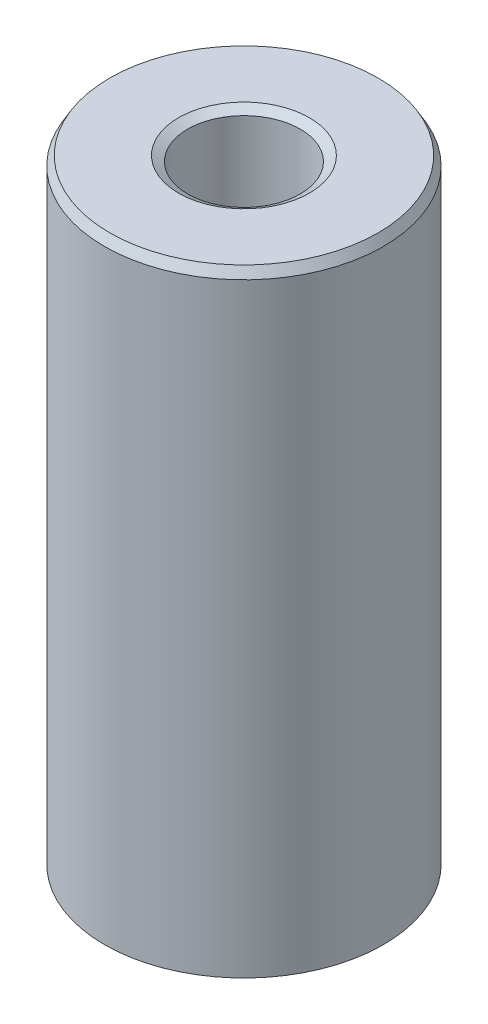
from build123d import *
from OCP.BRepFilletAPI import BRepFilletAPI_MakeChamfer

# Parameters (mm, degrees)
SKETCH1_R           = 12.5
BOSS_EXTRUDE1_DEPTH = 55.499589055
SKETCH2_R           = 5.042797886
CUT_EXTRUDE1_DEPTH  = 59.246925973
CHAMFER1_SIZE       = 0.820099803
CHAMFER1_SIZE2      = 0.473484842


with BuildPart() as part:
    # Sketch1 → Boss-Extrude1 (new body)
    with BuildSketch(Plane(origin=(0, 0, 0), x_dir=(1, 0, 0), z_dir=(0, 1, 0))):
        Circle(SKETCH1_R)
    extrude(amount=BOSS_EXTRUDE1_DEPTH)

    # Sketch2 → Cut-Extrude1 (cut, through all)
    with BuildSketch(Plane(origin=(0, 0, 0), x_dir=(1, 0, 0), z_dir=(0, 1, 0))):
        Circle(SKETCH2_R)
    extrude(amount=CUT_EXTRUDE1_DEPTH, mode=Mode.SUBTRACT)

    # Chamfer1: one chamfer whose edges measure the first distance from different faces: ONE call of the kernel's chamfer builder (chamfer() names one face for all edges)
    chamfer1_edges_1 = [part.edges().sort_by_distance(p)[0] for p in [
        (-5.042797886, 55.499589055, 0),
    ]]
    chamfer1_side_1 = [part.faces().sort_by_distance(p)[0] for p in [
        (-12.146446609, 55.499589055, 0),
    ]]
    chamfer1_edges_2 = [part.edges().sort_by_distance(p)[0] for p in [
        (-5.042797886, 0, 0),
    ]]
    chamfer1_side_2 = [part.faces().sort_by_distance(p)[0] for p in [
        (-5.042797886, 27.749794528, 0),
    ]]
    chamfer1_edges_3 = [part.edges().sort_by_distance(p)[0] for p in [
        (-12.5, 0, 0),
    ]]
    chamfer1_side_3 = [part.faces().sort_by_distance(p)[0] for p in [
        (-12.146446609, 0, 0),
    ]]
    chamfer1_edges_4 = [part.edges().sort_by_distance(p)[0] for p in [
        (-12.5, 55.499589055, 0),
    ]]
    chamfer1_side_4 = [part.faces().sort_by_distance(p)[0] for p in [
        (-12.5, 27.749794528, 0),
    ]]
    chamfer1 = BRepFilletAPI_MakeChamfer(part.part.solid().wrapped)
    for e in chamfer1_edges_1:
        chamfer1.Add(CHAMFER1_SIZE, CHAMFER1_SIZE2, e.wrapped, chamfer1_side_1[0].wrapped)  # the first distance lies on this face
    for e in chamfer1_edges_2:
        chamfer1.Add(CHAMFER1_SIZE, CHAMFER1_SIZE2, e.wrapped, chamfer1_side_2[0].wrapped)  # the first distance lies on this face
    for e in chamfer1_edges_3:
        chamfer1.Add(CHAMFER1_SIZE, CHAMFER1_SIZE2, e.wrapped, chamfer1_side_3[0].wrapped)  # the first distance lies on this face
    for e in chamfer1_edges_4:
        chamfer1.Add(CHAMFER1_SIZE, CHAMFER1_SIZE2, e.wrapped, chamfer1_side_4[0].wrapped)  # the first distance lies on this face
    add(Compound.cast(chamfer1.Shape()), mode=Mode.REPLACE)


solid = part.part
